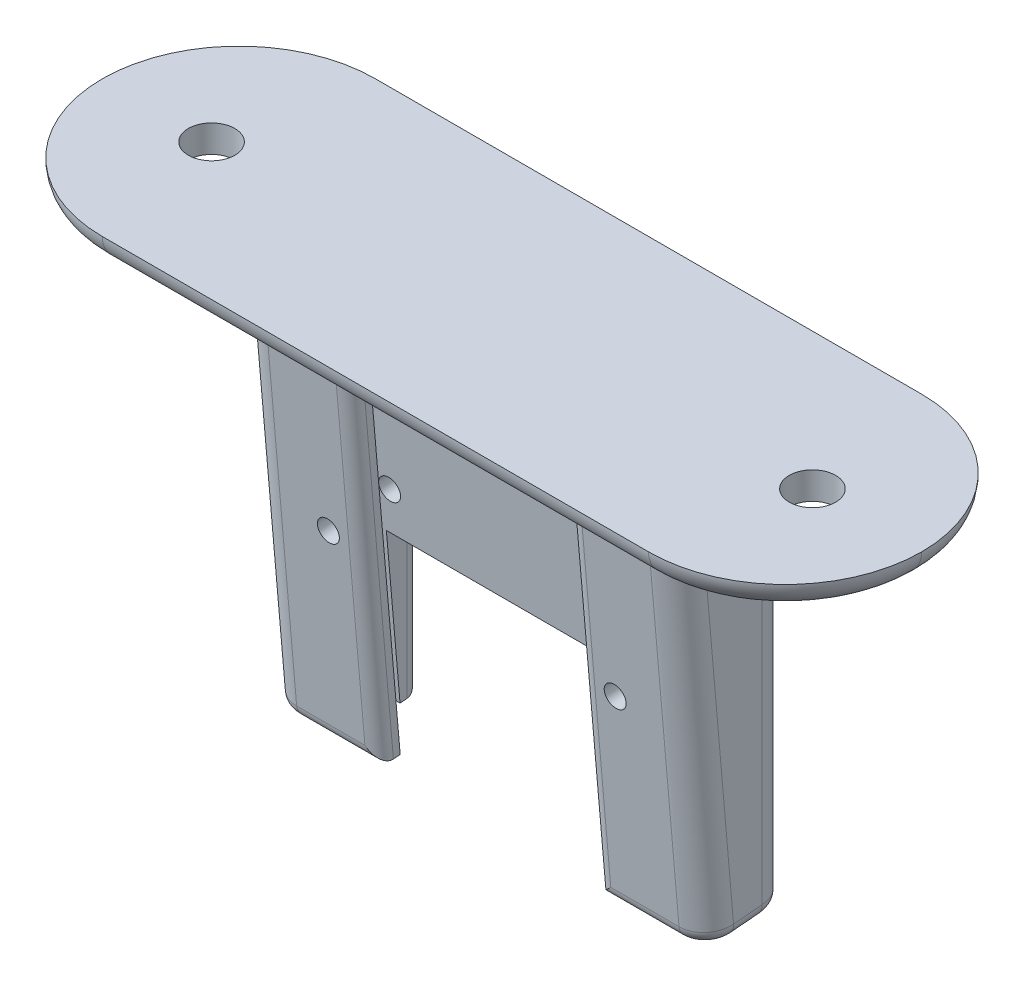
from build123d import *

# Parameters (mm, degrees)
ESQUISSE1_W                                   = 60
ESQUISSE1_H                                   = 20
BOSS_EXTRU_1_DEPTH                            = 2
BOSS_EXTRU_4_DEPTH                            = 16
ESQUISSE24_W                                  = 26
ESQUISSE24_H                                  = 3
ENL_V_MAT_EXTRU_9_DEPTH                       = 29
ESQUISSE25_W                                  = 16
ESQUISSE25_H                                  = 1.5
ENL_V_MAT_EXTRU_10_DEPTH                      = 27
ESQUISSE27_W                                  = 22
ESQUISSE27_H                                  = 11.5
ENL_V_MAT_EXTRU_12_DEPTH                      = 10
TROU_POUR_TARAUDAGE_POUR_TROU_TARAUD_M2_D     = 1.6
TROU_POUR_TARAUDAGE_POUR_TROU_TARAUD_M2_DEPTH = 12
TROU_POUR_TARAUDAGE_POUR_TROU_TARAUD_M2_TIP   = 0.480688495
CONG_7_R                                      = 10
CONG_5_R                                      = 2
CONG_6_R                                      = 1
D_GAGEMENT_M31_D                              = 3.4
D_GAGEMENT_M31_DEPTH                          = 5
D_GAGEMENT_M31_TIP                            = 1.021463052


with BuildPart() as part:
    # Esquisse1 → Boss.-Extru.1 (new body)
    with BuildSketch(Plane(origin=(0, 0, 0), x_dir=(1, 0, 0), z_dir=(0, 1, 0))):
        Rectangle(ESQUISSE1_W, ESQUISSE1_H)
    extrude(amount=BOSS_EXTRU_1_DEPTH)

    # Esquisse23 → Boss.-Extru.4 (add, symmetric)
    with BuildSketch(Plane(origin=(0, 0, 0), x_dir=(0, 0, -1), z_dir=(1, 0, 0))):
        Polygon((-4.295920235, 0), (4.295920235, 0), (4.295920235, -29.362906486), (-1.681247953, -29.885840943), align=None)
    extrude(amount=BOSS_EXTRU_4_DEPTH, both=True)

    # Esquisse24 → Enlèv. mat.-Extru.9 (cut)
    with BuildSketch(Plane(origin=(0, -29.512851583, -2.582039942), x_dir=(1, 0, 0), z_dir=(0, -0.9961946980917453, -0.08715574274766222))):
        with Locations((0, 1.279572962)):
            Rectangle(ESQUISSE24_W, ESQUISSE24_H)
    extrude(amount=-ENL_V_MAT_EXTRU_9_DEPTH, mode=Mode.SUBTRACT)

    # Esquisse25 → Enlèv. mat.-Extru.10 (cut)
    with BuildSketch(Plane(origin=(0, -29.512851583, -2.582039942), x_dir=(1, 0, 0), z_dir=(0, -0.9961946980917453, -0.08715574274766222))):
        with Locations((0, 3.529572962)):
            Rectangle(ESQUISSE25_W, ESQUISSE25_H)
    extrude(amount=-ENL_V_MAT_EXTRU_10_DEPTH, mode=Mode.SUBTRACT)

    # Esquisse27 → Enlèv. mat.-Extru.12 (cut)
    with BuildSketch(Plane(origin=(0, 0.019211482, -0.219588247), x_dir=(1, 0, 0), z_dir=(0, -0.08715574274766219, 0.9961946980917452))):
        with Locations((0, -23.875585881)):
            Rectangle(ESQUISSE27_W, ESQUISSE27_H)
    extrude(amount=-ENL_V_MAT_EXTRU_12_DEPTH, mode=Mode.SUBTRACT)

    # Trou pour taraudage pour trou taraudé M21
    with Locations(Plane(origin=(0, -0.37298936, 4.263287895), x_dir=(1, 0, 0), z_dir=(0, -0.08715574274766183, 0.9961946980917452))):
        with Locations((-10.5, -2.625585881), (-10.5, -15.125585881), (10.5, -2.625585881), (10.5, -15.125585881)):
            Hole(TROU_POUR_TARAUDAGE_POUR_TROU_TARAUD_M2_D / 2, depth=TROU_POUR_TARAUDAGE_POUR_TROU_TARAUD_M2_DEPTH)
            with Locations((0, 0, -(TROU_POUR_TARAUDAGE_POUR_TROU_TARAUD_M2_DEPTH + TROU_POUR_TARAUDAGE_POUR_TROU_TARAUD_M2_TIP / 2))):  # 118° drill point
                Cone(0, TROU_POUR_TARAUDAGE_POUR_TROU_TARAUD_M2_D / 2, TROU_POUR_TARAUDAGE_POUR_TROU_TARAUD_M2_TIP, mode=Mode.SUBTRACT)

    # Congé7
    cong_7_edges = [part.edges().sort_by_distance(p)[0] for p in [
        (-30, 1, -10),
        (30, 1, -10),
        (30, 1, 10),
        (-30, 1, 10),
    ]]
    fillet(cong_7_edges, radius=CONG_7_R - 0.0001)  # a hair under: the kernel refuses the full size

    # Congé5
    cong_5_edges = [part.edges().sort_by_distance(p)[0] for p in [
        (-16, -14.681453243, -4.295920235),
        (16, -14.681453243, -4.295920235),
        (16, -14.942920471, 2.988584094),
        (-16, -14.942920471, 2.988584094),
        (0, 0, -10),
        (0, 0, 10),
        (-27.071097101, 0, 7.071097101),
        (-27.071097101, 0, -7.071097101),
        (27.071097101, 0, -7.071097101),
        (27.071097101, 0, 7.071097101),
    ]]
    fillet(cong_5_edges, radius=CONG_5_R - 0.0001)  # a hair under: the kernel refuses the full size

    # Congé6
    cong_6_edges = [part.edges().sort_by_distance(p)[0] for p in [
        (0, 0, -4.295920235),
        (-16, 0, -0.003819647),
        (0, 0, 4.295920235),
        (16, 0, -0.003819647),
        (12.50005, -29.362906486, -4.295920235),
        (-16, -29.624706619, -1.30353103),
        (-15.414242852, -29.834788843, 1.097719788),
        (-15.415590078, -29.414271576, -3.708814576),
        (16, -29.624706619, -1.30353103),
        (11.00005, -29.885840943, 1.681247953),
        (15.414242852, -29.834788843, 1.097719788),
        (15.415590078, -29.414271576, -3.708814576),
        (-15.414242852, 0, -3.710163087),
        (15.414242852, 0, -3.710163087),
        (15.415590078, 0, 3.706571928),
        (-15.415590078, 0, 3.706571928),
        (-11.00005, -29.885840943, 1.681247953),
        (-8, -16.437212519, 2.85785048),
        (8, -16.437212519, 2.85785048),
        (0, -2.988584094, 4.034453007),
        (-12.50005, -29.362906486, -4.295920235),
        (-11, -23.59094242, -4.295920235),
        (0, -17.818978355, -4.295920235),
        (11, -23.59094242, -4.295920235),
    ]]
    fillet(cong_6_edges, radius=CONG_6_R)

    # Dégagement M31
    with Locations(Plane(origin=(0, 0, 0), x_dir=(-1, 0, 0), z_dir=(0, -1, 0))):
        with Locations((22, 0), (-22, 0)):
            Hole(D_GAGEMENT_M31_D / 2, depth=D_GAGEMENT_M31_DEPTH)
            with Locations((0, 0, -(D_GAGEMENT_M31_DEPTH + D_GAGEMENT_M31_TIP / 2))):  # 118° drill point
                Cone(0, D_GAGEMENT_M31_D / 2, D_GAGEMENT_M31_TIP, mode=Mode.SUBTRACT)


solid = part.part
